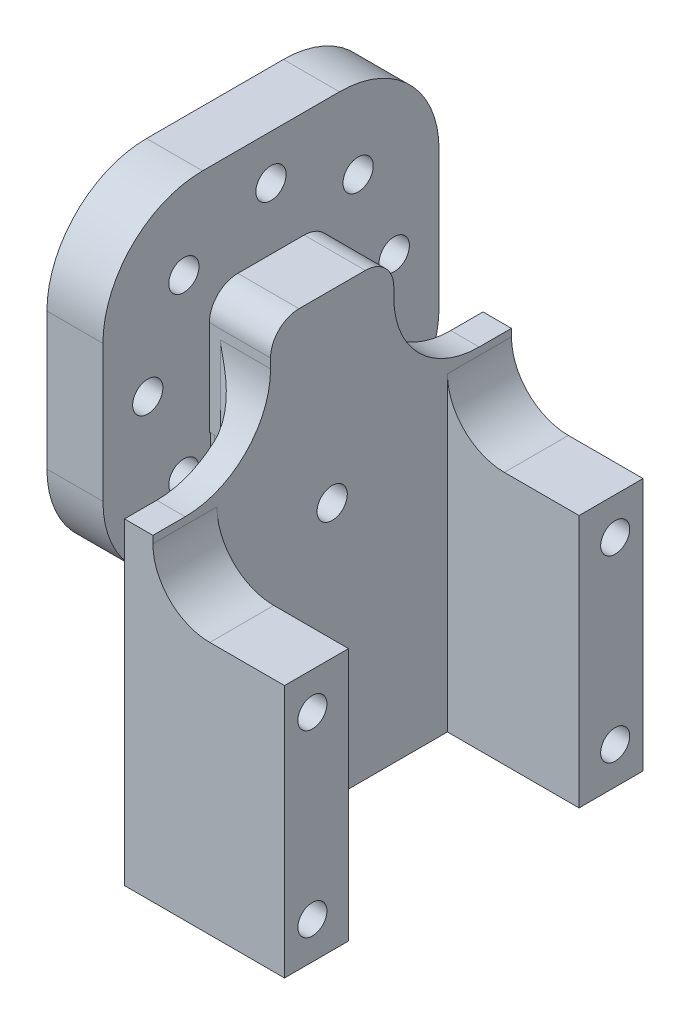
from build123d import *

# Parameters (mm, degrees)
BOSS_EXTRUDE1_DEPTH = 45
SKETCH4_R           = 1.35
CUT_EXTRUDE3_DEPTH  = 88.759301296
SKETCH16_W          = 54.601375451
SKETCH16_H          = 80.563035577
CUT_EXTRUDE6_DEPTH  = 86.719849393
SKETCH17_W          = 45
SKETCH17_H          = 36.75
SKETCH17_W_2        = 30
SKETCH17_H_2        = 30
CUT_EXTRUDE7_DEPTH  = 74.310606081
SKETCH18_R          = 1.35
CUT_EXTRUDE8_DEPTH  = 64.93499752
FILLET1_R           = 8.89
SKETCH19_W          = 11
SKETCH19_H          = 11
BOSS_EXTRUDE2_DEPTH = 2.921
SKETCH20_W          = 5
SKETCH20_H          = 5
CUT_EXTRUDE9_DEPTH  = 25
SKETCH26_W          = 32.004
SKETCH26_H          = 43.2054
BOSS_EXTRUDE3_DEPTH = 2.54
SKETCH27_W          = 32.004
SKETCH27_H          = 22.606
BOSS_EXTRUDE4_DEPTH = 11.7475
SKETCH28_R          = 1.2954
CUT_EXTRUDE11_DEPTH = 19.05
CUT_EXTRUDE14_DEPTH = 3.81
SKETCH32_W          = 2.921
SKETCH32_H          = 9.5
BOSS_EXTRUDE5_DEPTH = 10.922
SKETCH33_W          = 11.7475
SKETCH33_H          = 20.574
CUT_EXTRUDE15_DEPTH = 78.55193447
FILLET2_R           = 5.08
FILLET3_R           = 5.08
FILLET4_R           = 7.62
FILLET5_R           = 7.62
FILLET6_R           = 7.62
FILLET7_R           = 2.54
FILLET8_R           = 2.54
FILLET9_R           = 2.54
FILLET10_R          = 2.54
CUT_EXTRUDE16_START = -11.43
SKETCH34_R          = 1.35
CUT_EXTRUDE16_DEPTH = 11.43


with BuildPart() as part:
    # Sketch1 → Boss-Extrude1 (new body)
    with BuildSketch(Plane.XY):
        Polygon((-3.796, -4.492), (-3.796, 57.658), (44.704, 57.658), (44.704, 20.908), (39.704, 20.908), (39.704, 52.658), (1.204, 52.658), (1.204, -4.492), align=None)
    extrude(amount=BOSS_EXTRUDE1_DEPTH)

    # Sketch4 → Cut-Extrude3 (cut, through all)
    with BuildSketch(Plane(origin=(44.704, 0, 0), x_dir=(0, 0, -1), z_dir=(1, 0, 0))):
        with Locations(Location((-22.6336, 47.4432, 0), (0, 0, 90))):
            Circle(SKETCH4_R)
        with Locations(Location((-22.6336, 25.448, 0), (0, 0, 90))):
            Circle(SKETCH4_R)
        with Locations(Location((-11.6341, 36.4435, 0), (0, 0, 90))):
            Circle(SKETCH4_R)
        with Locations(Location((-33.6321, 36.4435, 0), (0, 0, 90))):
            Circle(SKETCH4_R)
    extrude(amount=-CUT_EXTRUDE3_DEPTH, mode=Mode.SUBTRACT)

    # Sketch16 → Cut-Extrude6 (cut, through all)
    with BuildSketch(Plane.XY.offset(45)):
        with Locations((12.403312274, 23.911522997)):
            Rectangle(SKETCH16_W, SKETCH16_H)
    extrude(amount=-CUT_EXTRUDE6_DEPTH, mode=Mode.SUBTRACT)

    # Sketch17 → Cut-Extrude7 (cut, through all)
    with BuildSketch(Plane(origin=(44.704, 0, 0), x_dir=(0, 0, -1), z_dir=(1, 0, 0))):
        with Locations((-22.5, 39.283)):
            Rectangle(SKETCH17_W, SKETCH17_H)
        with Locations((-22.6331, 36.4435)):
            Rectangle(SKETCH17_W_2, SKETCH17_H_2, mode=Mode.SUBTRACT)
    extrude(amount=-CUT_EXTRUDE7_DEPTH, mode=Mode.SUBTRACT)

    # Sketch18 → Cut-Extrude8 (cut, through all)
    with BuildSketch(Plane(origin=(44.704, 0, 0), x_dir=(0, 0, -1), z_dir=(1, 0, 0))):
        with Locations(Location((-14.857193174, 44.222006826, 0), (0, 0, 90))):
            Circle(SKETCH18_R)
        with Locations(Location((-30.410360379, 28.668839621, 0), (0, 0, 90))):
            Circle(SKETCH18_R)
        with Locations(Location((-14.856839621, 28.668839621, 0), (0, 0, 90))):
            Circle(SKETCH18_R)
        with Locations(Location((-30.410360379, 44.222006826, 0), (0, 0, 90))):
            Circle(SKETCH18_R)
    extrude(amount=-CUT_EXTRUDE8_DEPTH, mode=Mode.SUBTRACT)

    # Fillet1
    fillet1_edges = [part.edges().sort_by_distance(p)[0] for p in [
        (42.204, 51.4435, 7.6331),
        (42.204, 51.4435, 37.6331),
        (42.204, 21.4435, 37.6331),
        (42.204, 21.4435, 7.6331),
    ]]
    fillet(fillet1_edges, radius=FILLET1_R)

    # Sketch19 → Boss-Extrude2 (add)
    with BuildSketch(Plane(origin=(44.704, 0, 0), x_dir=(0, 0, -1), z_dir=(1, 0, 0))):
        with Locations((-22.6336, 36.4435)):
            Rectangle(SKETCH19_W, SKETCH19_H)
    extrude(amount=BOSS_EXTRUDE2_DEPTH)

    # Sketch20 → Cut-Extrude9 (cut)
    with BuildSketch(Plane(origin=(47.625, 0, 0), x_dir=(0, 0, -1), z_dir=(1, 0, 0))):
        with Locations((-22.6336, 36.4435)):
            Rectangle(SKETCH20_W, SKETCH20_H)
    extrude(amount=-CUT_EXTRUDE9_DEPTH, mode=Mode.SUBTRACT)

    # Sketch26 → Boss-Extrude3 (add)
    with BuildSketch(Plane(origin=(47.625, 0, 0), x_dir=(0, 0, -1), z_dir=(1, 0, 0))):
        with Locations((-22.6336, 24.202149454)):
            Rectangle(SKETCH26_W, SKETCH26_H)
    extrude(amount=BOSS_EXTRUDE3_DEPTH)

    # Sketch27 → Boss-Extrude4 (add)
    with BuildSketch(Plane(origin=(50.165, 0, 0), x_dir=(0, 0, -1), z_dir=(1, 0, 0))):
        with Locations((-22.6336, 13.902449454)):
            Rectangle(SKETCH27_W, SKETCH27_H)
    extrude(amount=BOSS_EXTRUDE4_DEPTH)

    # Sketch28 → Cut-Extrude11 (cut)
    with BuildSketch(Plane(origin=(61.9125, 0, 0), x_dir=(0, 0, -1), z_dir=(1, 0, 0))):
        with Locations((-9.1208, 21.903449454)):
            Circle(SKETCH28_R)
        with Locations((-9.1208, 5.901449454)):
            Circle(SKETCH28_R)
        with Locations((-36.1464, 5.901449454)):
            Circle(SKETCH28_R)
        with Locations((-36.1464, 21.903449454)):
            Circle(SKETCH28_R)
    extrude(amount=-CUT_EXTRUDE11_DEPTH, mode=Mode.SUBTRACT)

    # Sketch31 → Cut-Extrude14 (cut)
    with BuildSketch(Plane(origin=(50.165, 0, 0), x_dir=(0, 0, -1), z_dir=(1, 0, 0))):
        Polygon((-38.6356, 45.804849454), (-38.6356, 30.9435), (-28.1336, 30.9435), (-28.1336, 41.9435), (-17.1336, 41.9435), (-17.1336, 30.9435), (-6.6316, 30.9435), (-6.6316, 45.804849454), align=None)
    extrude(amount=-CUT_EXTRUDE14_DEPTH, mode=Mode.SUBTRACT)

    # Sketch32 → Boss-Extrude5 (add)
    with BuildSketch(Plane(origin=(0, 0, 17.1336), x_dir=(-1, 0, 0), z_dir=(0, 0, -1))):
        with Locations((-46.1645, 26.1935)):
            Rectangle(SKETCH32_W, SKETCH32_H)
    extrude(amount=-BOSS_EXTRUDE5_DEPTH)

    # Sketch33 → Cut-Extrude15 (cut, through all)
    with BuildSketch(Plane(origin=(0, 25.205449454, 0), x_dir=(1, 0, 0), z_dir=(0, 1, 0))):
        with Locations((56.03875, -22.6336)):
            Rectangle(SKETCH33_W, SKETCH33_H)
    extrude(amount=-CUT_EXTRUDE15_DEPTH, mode=Mode.SUBTRACT)

    # Fillet2
    fillet2_edges = [part.edges().sort_by_distance(p)[0] for p in [
        (50.165, 25.205449454, 35.7781),
    ]]
    fillet(fillet2_edges, radius=FILLET2_R)

    # Fillet3
    fillet3_edges = [part.edges().sort_by_distance(p)[0] for p in [
        (50.165, 25.205449454, 9.4891),
    ]]
    fillet(fillet3_edges, radius=FILLET3_R)

    # Fillet4
    # the kernel refuses this fillet: 7.62 mm, written as the material it adds along each edge
    with BuildSketch(Plane(origin=(47.625, 21.4435, 17.1336), x_dir=(-1, 0, 0), z_dir=(0, 0, 1))) as fillet4_piece_1:
        with BuildLine():
            CenterArc((FILLET4_R, FILLET4_R), FILLET4_R, 180, 90)
            Line((0, FILLET4_R), (0, 0))
            Line((0, 0), (FILLET4_R, 0))
        make_face()
    extrude(amount=10.922)

    # Fillet5
    fillet5_edges = [part.edges().sort_by_distance(p)[0] for p in [
        (48.895, 30.9435, 17.1336),
    ]]
    fillet(fillet5_edges, radius=FILLET5_R)

    # Fillet6
    fillet6_edges = [part.edges().sort_by_distance(p)[0] for p in [
        (48.895, 30.9435, 28.1336),
    ]]
    fillet(fillet6_edges, radius=FILLET6_R)

    # Fillet7
    fillet7_edges = [part.edges().sort_by_distance(p)[0] for p in [
        (47.4345, 41.9435, 28.1336),
    ]]
    fillet(fillet7_edges, radius=FILLET7_R)

    # Fillet8
    fillet8_edges = [part.edges().sort_by_distance(p)[0] for p in [
        (47.4345, 41.9435, 17.1336),
    ]]
    fillet(fillet8_edges, radius=FILLET8_R)

    # Fillet9
    fillet9_edges = [part.edges().sort_by_distance(p)[0] for p in [
        (47.625, 22.3835, 28.0556),
    ]]
    fillet(fillet9_edges, radius=FILLET9_R)

    # Fillet10
    fillet10_edges = [part.edges().sort_by_distance(p)[0] for p in [
        (47.625, 26.1935, 17.1336),
    ]]
    fillet(fillet10_edges, radius=FILLET10_R)

    # Sketch34 → Cut-Extrude16 (cut)
    with BuildSketch(Plane.ZY.offset(-39.704).offset(CUT_EXTRUDE16_START)):
        with Locations(Location((22.6336, 25.448, 0), (0, 0, 90))):
            Circle(SKETCH34_R)
    extrude(amount=CUT_EXTRUDE16_DEPTH, mode=Mode.SUBTRACT)


solid = part.part
